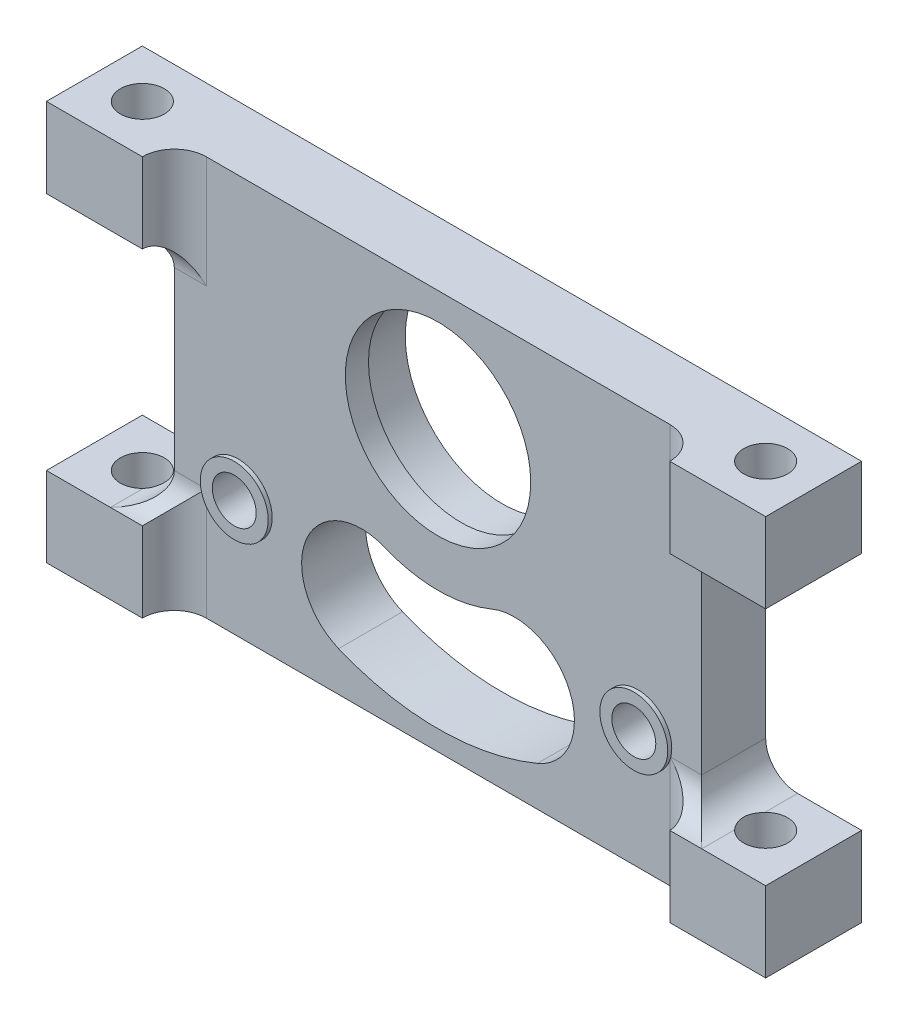
from build123d import *

# Parameters (mm, degrees)
SKETCH1_W           = 33
SKETCH1_H           = 50
BOSS_EXTRUDE1_DEPTH = 8
SKETCH2_W           = 12
SKETCH2_H           = 10
BOSS_EXTRUDE2_DEPTH = 12
FILLET1_R           = 4
FILLET2_R           = 4
SKETCH3_R           = 2.75
SKETCH3_R_2         = 11.6
CUT_EXTRUDE1_DEPTH  = 104.266645155
BOSS_EXTRUDE3_START = 0.5
SKETCH4_R           = 4.25
SKETCH4_R_2         = 2.75
BOSS_EXTRUDE3_DEPTH = 0.5
SKETCH7_R           = 2.75
CUT_EXTRUDE3_DEPTH  = 104.653268207
SKETCH6_R           = 12.1
CUT_EXTRUDE2_DEPTH  = 5.1
CHAMFER1_SIZE       = 2.5


with BuildPart() as part:
    # Sketch1 → Boss-Extrude1 (new body)
    with BuildSketch(Plane.XY):
        with Locations((61.5, 25)):
            Rectangle(SKETCH1_W, SKETCH1_H)
    extrude(amount=BOSS_EXTRUDE1_DEPTH)

    # Sketch2 → Boss-Extrude2 (add)
    with BuildSketch(Plane(origin=(0, 0, 0), x_dir=(-1, 0, 0), z_dir=(0, 0, -1))):
        with Locations((-84, 45)):
            Rectangle(SKETCH2_W, SKETCH2_H)
        with Locations((-84, 5)):
            Rectangle(SKETCH2_W, SKETCH2_H)
    extrude(amount=-BOSS_EXTRUDE2_DEPTH)

    # Fillet1
    fillet1_edges = [part.edges().sort_by_distance(p)[0] for p in [
        (78, 40, 4),
        (78, 10, 4),
    ]]
    fillet(fillet1_edges, radius=FILLET1_R)

    # Fillet2
    fillet2_edges = [part.edges().sort_by_distance(p)[0] for p in [
        (78, 5, 8),
        (80, 10, 8),
        (78, 45, 8),
        (80, 40, 8),
    ]]
    fillet(fillet2_edges, radius=FILLET2_R - 0.0001)  # a hair under: the kernel refuses the full size

    # Sketch3 → Cut-Extrude1 (cut, through all)
    with BuildSketch(Plane.XY.offset(8)):
        with Locations((69.99999756, 15.000000247)):
            Circle(SKETCH3_R)
        with Locations((45, 35)):
            Circle(SKETCH3_R_2)
        with BuildLine():
            Line((27.5, 35), (12.5, 35))
            ThreePointArc((12.5, 35), (26.943967427, 7.9772376), (57.437211552, 4.973915193))
            ThreePointArc((57.437211552, 4.973915193), (61.496182303, 14.77313743), (51.696960066, 18.832108181))
            ThreePointArc((51.696960066, 18.832108181), (35.277520922, 20.449281785), (27.5, 35))
        make_face()
    extrude(amount=-CUT_EXTRUDE1_DEPTH, mode=Mode.SUBTRACT)

    # Sketch4 → Boss-Extrude3 (add)
    with BuildSketch(Plane.XY.offset(8).offset(BOSS_EXTRUDE3_START)):
        with Locations(Location((69.99999756, 15.000000247, 0), (0, 0, 340.25017454))):
            Circle(SKETCH4_R)
        with Locations((69.99999756, 15.000000247)):
            Circle(SKETCH4_R_2, mode=Mode.SUBTRACT)
    extrude(amount=-BOSS_EXTRUDE3_DEPTH)

    # Sketch7 → Cut-Extrude3 (cut, through all)
    with BuildSketch(Plane(origin=(0, 50, 0), x_dir=(1, 0, 0), z_dir=(0, 1, 0))):
        with Locations(Location((84, -6, 0), (0, 0, 180))):
            Circle(SKETCH7_R)
    extrude(amount=-CUT_EXTRUDE3_DEPTH, mode=Mode.SUBTRACT)

    # Mirror1: part across plane


with BuildPart() as part_1:
    add(part.part)
    add(part.part.mirror(Plane(origin=(45, 50, 8), x_dir=(0, 0, 1), z_dir=(1, 0, 0))))

    # Sketch6 → Cut-Extrude2 (cut)
    with BuildSketch(Plane(origin=(0, 0, 0), x_dir=(-1, 0, 0), z_dir=(0, 0, -1))):
        with Locations((-45, 35)):
            Circle(SKETCH6_R)
    extrude(amount=-CUT_EXTRUDE2_DEPTH, mode=Mode.SUBTRACT)

    # Chamfer1
    chamfer1_edges = [part_1.edges().sort_by_distance(p)[0] for p in [
        (22.75000244, 15.000000247, 0),
        (67.24999756, 15.000000247, 0),
    ]]
    chamfer(chamfer1_edges, length=CHAMFER1_SIZE)


solid = part_1.part
